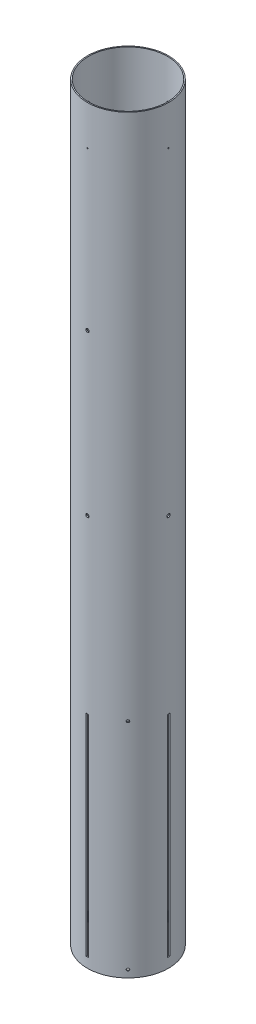
from build123d import *

# Parameters (mm, degrees)
SUSTAINER_TUBE_PROFILE_R       = 78.359
SUSTAINER_TUBE_PROFILE_R_2     = 76.2
SUSTAINER_TUBE_BODY_DEPTH      = 1447.8
FIN_SLOT_CUT_REACH             = 1460.364
FIN_SLOT_CUT_END_RADIUS        = 76.2
FIN_SLOT_PROFILE_W             = 4.7625
FIN_SLOT_PROFILE_H             = 406.4
FIN_SLOT_PATTERN_COUNT         = 4
SKETCH1_R                      = 1.143
CUT_EXTRUDE1_DEPTH             = 1453.034815616
CIRPATTERN1_COUNT              = 4
CUT_EXTRUDE2_DEPTH             = 1453.034815727
CUT_EXTRUDE2_DEPTH_BACK        = 1453.034815727
SKETCH2_R                      = 3.175
SKETCH3_R                      = 3.175
CUT_EXTRUDE3_DEPTH             = 1453.034815727
CIRPATTERN2_COUNT              = 4
CUT_EXTRUDE4_REACH             = 1462.107
CUT_EXTRUDE4_END_RADIUS        = 76.2
SKETCH4_R                      = 2.5019
CUT_EXTRUDE4_DIRECTION_2_DEPTH = 1461.106899298


with BuildPart() as part:
    # Sustainer Tube Profile → Sustainer Tube Body (new body)
    with BuildSketch(Plane(origin=(0, 0, 0), x_dir=(1, 0, 0), z_dir=(0, 1, 0))):
        Circle(SUSTAINER_TUBE_PROFILE_R)
        Circle(SUSTAINER_TUBE_PROFILE_R_2, mode=Mode.SUBTRACT)
    extrude(amount=SUSTAINER_TUBE_BODY_DEPTH)

    # Fin Slot Cut: up to this cylinder (the profile starts outside it)
    fin_slot_cut_end = Plane(origin=(0, 222.25, 0), z_dir=(0, -1, 0)) * Cylinder(FIN_SLOT_CUT_END_RADIUS, 3074.128, mode=Mode.PRIVATE)
    # Fin Slot Profile → Fin Slot Cut (cut, up to the surface)
    with BuildSketch(Plane.XY.offset(78.359), mode=Mode.PRIVATE) as fin_slot_cut_sk1:
        with Locations((0, 222.25)):
            Rectangle(FIN_SLOT_PROFILE_W, FIN_SLOT_PROFILE_H)
    fin_slot_cut_tool1 = extrude(fin_slot_cut_sk1.sketch, amount=-FIN_SLOT_CUT_REACH, mode=Mode.PRIVATE) - fin_slot_cut_end
    fin_slot_cut = fin_slot_cut_tool1.solids().sort_by_distance((0, 222.25, 78.359))[0]
    add(fin_slot_cut, mode=Mode.SUBTRACT)

    # Fin Slot Pattern: Fin Slot Cut ×4 about axis
    fin_slot_pattern_axis = Axis((0, 1447.8, 0), (0, 1, 0))
    for i in range(1, FIN_SLOT_PATTERN_COUNT):
        add(fin_slot_cut.rotate(fin_slot_pattern_axis, i * 360 / FIN_SLOT_PATTERN_COUNT), mode=Mode.SUBTRACT)

    # Sketch1 → Cut-Extrude1 (cut, symmetric)
    with BuildSketch(Plane.XY):
        with Locations((0, 1371.6)):
            Circle(SKETCH1_R)
    cut_extrude1 = extrude(amount=CUT_EXTRUDE1_DEPTH, both=True, mode=Mode.SUBTRACT)

    # CirPattern1: Cut-Extrude1 ×4 about axis
    cirpattern1_axis = Axis((0, 1447.8, 0), (0, 1, 0))
    for i in range(1, CIRPATTERN1_COUNT):
        add(cut_extrude1.rotate(cirpattern1_axis, i * 360 / CIRPATTERN1_COUNT), mode=Mode.SUBTRACT)

    # Sketch2 → Cut-Extrude2 (cut, two sides: drawn at the far end of the back side and taken through both)
    with BuildSketch(Plane.XY.offset(-CUT_EXTRUDE2_DEPTH_BACK)):
        with Locations((0, 1066.8)):
            Circle(SKETCH2_R)
    extrude(amount=CUT_EXTRUDE2_DEPTH + CUT_EXTRUDE2_DEPTH_BACK, mode=Mode.SUBTRACT)

    # Sketch3 → Cut-Extrude3 (cut, symmetric)
    with BuildSketch(Plane.XY):
        with Locations((0, 756.9962)):
            Circle(SKETCH3_R)
    cut_extrude3 = extrude(amount=CUT_EXTRUDE3_DEPTH, both=True, mode=Mode.SUBTRACT)

    # CirPattern2: Cut-Extrude3 ×4 about axis
    cirpattern2_axis = Axis((0, 1447.8, 0), (0, 1, 0))
    for i in range(1, CIRPATTERN2_COUNT):
        add(cut_extrude3.rotate(cirpattern2_axis, i * 360 / CIRPATTERN2_COUNT), mode=Mode.SUBTRACT)

    # Cut-Extrude4: up to this cylinder (the profile starts outside it)
    cut_extrude4_end = Plane(origin=(0, 221.74454, 0), z_dir=(0, -1, 0)) * Cylinder(CUT_EXTRUDE4_END_RADIUS, 3493.01068, mode=Mode.PRIVATE)
    # Sketch4 → Cut-Extrude4 (cut, up to the surface)
    with BuildSketch(Plane(origin=(55.408180267, 0, 55.408180267), x_dir=(0, -1, 0), z_dir=(0.7071067811865488, 0, 0.7071067811865464)), mode=Mode.PRIVATE) as cut_extrude4_sk1:
        with Locations((-14.0462, 0)):
            Circle(SKETCH4_R)
    cut_extrude4_tool1 = extrude(cut_extrude4_sk1.sketch, amount=-CUT_EXTRUDE4_REACH, mode=Mode.PRIVATE) - cut_extrude4_end
    add(cut_extrude4_tool1.solids().sort_by_distance((55.40818, 14.0462, 55.40818))[0], mode=Mode.SUBTRACT)
    # Sketch4 → Cut-Extrude4 (cut, up to the surface)
    with BuildSketch(Plane(origin=(55.408180267, 0, 55.408180267), x_dir=(0, -1, 0), z_dir=(0.7071067811865488, 0, 0.7071067811865464)), mode=Mode.PRIVATE) as cut_extrude4_sk2:
        with Locations((-429.44288, 0)):
            Circle(SKETCH4_R)
    cut_extrude4_tool2 = extrude(cut_extrude4_sk2.sketch, amount=-CUT_EXTRUDE4_REACH, mode=Mode.PRIVATE) - cut_extrude4_end
    add(cut_extrude4_tool2.solids().sort_by_distance((55.40818, 429.44288, 55.40818))[0], mode=Mode.SUBTRACT)

    # Sketch4 → Cut-Extrude4 direction 2 (cut)
    with BuildSketch(Plane(origin=(55.408180267, 0, 55.408180267), x_dir=(0, -1, 0), z_dir=(0.7071067811865488, 0, 0.7071067811865464))):
        with Locations((-14.0462, 0)):
            Circle(SKETCH4_R)
        with Locations((-429.44288, 0)):
            Circle(SKETCH4_R)
    extrude(amount=CUT_EXTRUDE4_DIRECTION_2_DEPTH, mode=Mode.SUBTRACT)


solid = part.part
